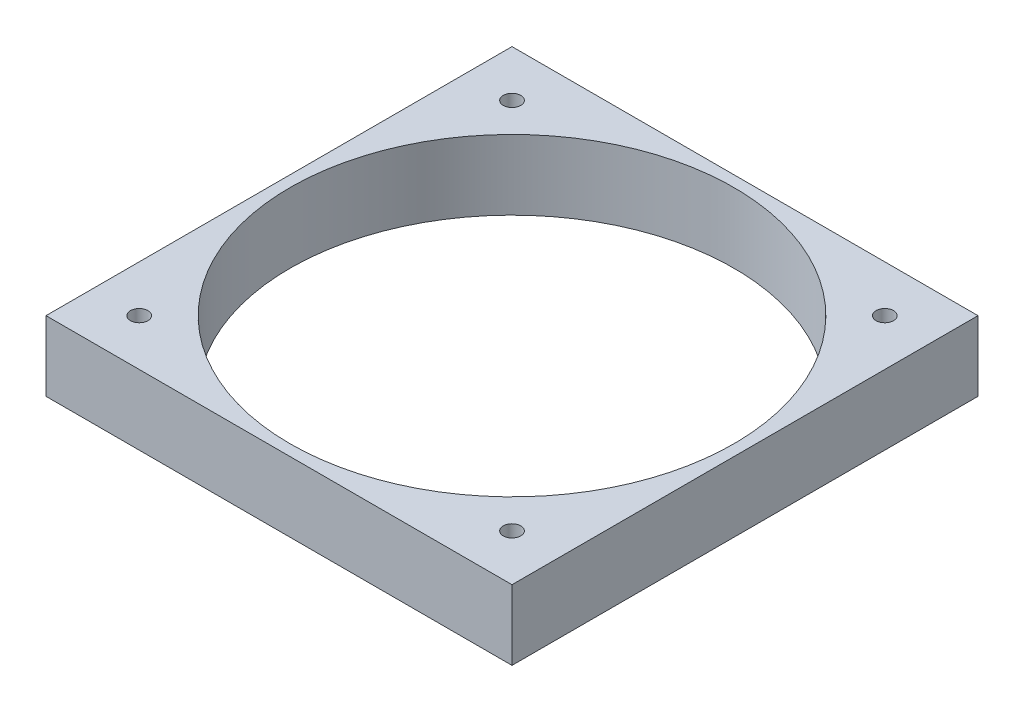
from build123d import *

# Parameters (mm, degrees)
SKETCH1_W           = 40
SKETCH1_H           = 40
SKETCH1_R           = 0.75
SKETCH1_R_2         = 19.05
BOSS_EXTRUDE1_DEPTH = 6


with BuildPart() as part:
    # Sketch1 → Boss-Extrude1 (new body)
    with BuildSketch(Plane(origin=(0, 0, 0), x_dir=(1, 0, 0), z_dir=(0, 1, 0))):
        with Locations((20, 20)):
            Rectangle(SKETCH1_W, SKETCH1_H)
        with Locations((4, 36)):
            Circle(SKETCH1_R, mode=Mode.SUBTRACT)
        with Locations((36, 36)):
            Circle(SKETCH1_R, mode=Mode.SUBTRACT)
        with Locations((4, 4)):
            Circle(SKETCH1_R, mode=Mode.SUBTRACT)
        with Locations((36, 4)):
            Circle(SKETCH1_R, mode=Mode.SUBTRACT)
        with Locations((20, 20)):
            Circle(SKETCH1_R_2, mode=Mode.SUBTRACT)
    extrude(amount=BOSS_EXTRUDE1_DEPTH)


solid = part.part
